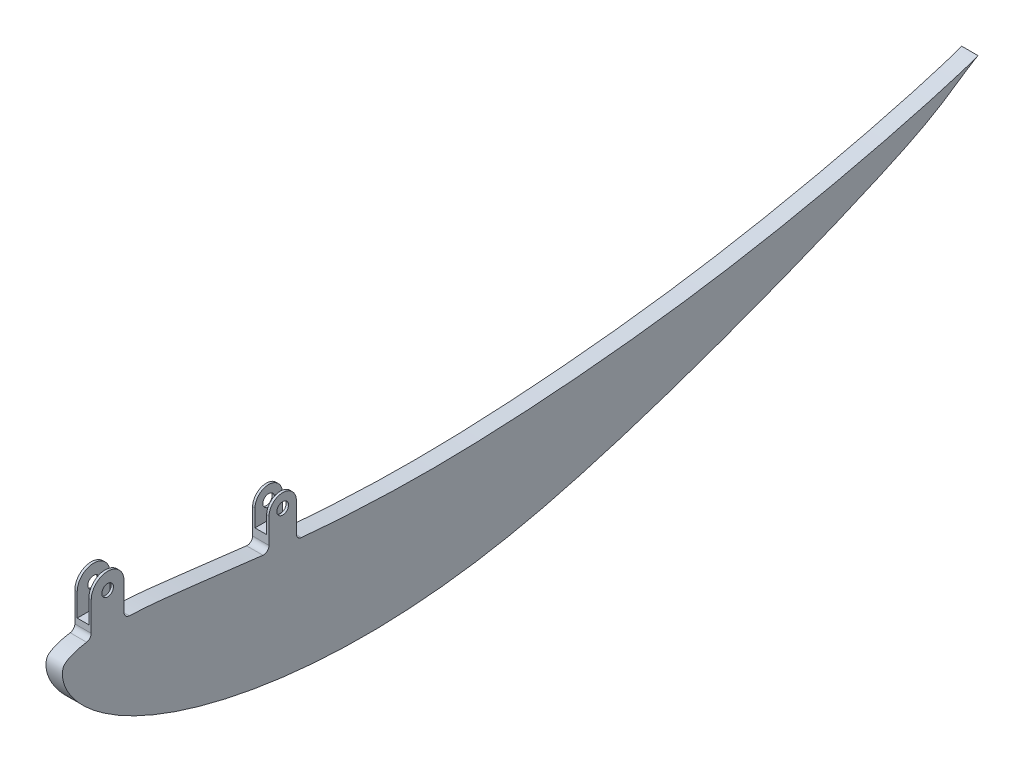
from build123d import *

# Parameters (mm, degrees)
SKETCH10_R          = 3.3782
BOSS_EXTRUDE3_DEPTH = 4.7625
FILLET1_R           = 3.175
SKETCH11_W          = 49.180841289
SKETCH11_H          = 41.157995699
SKETCH11_W_2        = 33.005126503
SKETCH11_H_2        = 27.785711149
CUT_EXTRUDE2_DEPTH  = 3.3782


with BuildPart() as part:
    # Sketch10 → Boss-Extrude3 (new, symmetric)
    with BuildSketch(Plane(origin=(-76.913317281, 0, 0), x_dir=(0, 0, -1), z_dir=(1, 0, 0))):
        with BuildLine():
            Line((424.6411251, 925.56881761), (424.6411251, 905.857301798))
            add(Edge.make_bspline(
                [(424.6411251, 905.857301798), (423.945652944, 905.774703814), (420.525882084, 905.325504915), (416.573283914, 904.537907427), (412.940662307, 903.120412878), (411.573177088, 902.472936622), (410.474599814, 901.817379847), (409.794744242, 901.335782482), (409.339677052, 900.920330878), (409.042207277, 900.619525556), (408.784556315, 900.303921905), (408.587304247, 899.955317553), (408.417771895, 899.584396657), (408.237439409, 899.045054034), (408.050985255, 898.323866051), (407.911585152, 897.226493937), (407.859927906, 894.999149718), (408.68651392, 890.840217441), (411.376000996, 884.946014898), (416.25391737, 878.254816024), (423.132675249, 871.411144687), (431.981552695, 864.594650088), (442.753920117, 857.982519555), (455.382043243, 851.727453866), (469.76495433, 845.961461457), (485.786519626, 840.806471362), (503.304073155, 836.369991877), (522.15856297, 832.757498728), (542.167589645, 830.052058954), (563.145876614, 828.350450786), (584.926560949, 827.796453196), (607.349161879, 828.463904852), (630.278164353, 830.40345119), (653.58544904, 833.656986938), (677.184512168, 838.243674796), (700.98973836, 844.111293992), (724.928449617, 850.915307518), (748.823162114, 858.397918758), (772.401865862, 866.368085261), (795.392079425, 874.604570932), (817.507453816, 882.912333682), (838.451534111, 891.127800517), (857.939094567, 899.08092447), (875.67746411, 906.643284295), (891.41607084, 913.715551659), (904.921254426, 920.249689629), (916.209983753, 926.570936945), (924.887186218, 932.328637386), (932.384753705, 937.363798289), (935.676703204, 939.716333859), (940.314704509, 942.154799385), (935.252865423, 940.050693146), (930.971572534, 938.763984852), (920.691607442, 935.460998702), (907.955315783, 931.908700898), (891.294887337, 927.47431092), (871.521761407, 922.604159426), (848.573928973, 917.416460042), (822.769468157, 912.150284242), (794.390431685, 907.047528902), (763.843566945, 902.44822661), (731.632596414, 898.583575164), (698.294192795, 895.504846252), (664.329350338, 893.303833795), (630.291363455, 892.15873472), (596.91773512, 892.45793122), (568.119025793, 893.993021629), (550.570865957, 895.432987488), (543.7036251, 896.066896175)],
                knots=[0.465548295, 0.465548295, 0.465548295, 0.465548295, 0.467425396, 0.47478648, 0.476279685, 0.477883717, 0.478839792, 0.479711359, 0.480113154, 0.480492024, 0.480846456, 0.481202587, 0.481563638, 0.481939612, 0.482727348, 0.483558572, 0.484902837, 0.488691659, 0.494806066, 0.502149414, 0.51079641, 0.520764117, 0.532061881, 0.544665778, 0.558541304, 0.573611819, 0.589802913, 0.607010014, 0.625106992, 0.64396663, 0.663469284, 0.683551422, 0.704141715, 0.725196117, 0.746680345, 0.768632951, 0.790977273, 0.813463266, 0.835826601, 0.857771603, 0.879002655, 0.899227861, 0.918150719, 0.935487385, 0.95098692, 0.964427758, 0.975827857, 0.985423652, 0.993088672, 0.998187309, 1, 1.001841176, 1.007308484, 1.016237151, 1.028456325, 1.043801368, 1.062125827, 1.083239553, 1.106895519, 1.132816624, 1.160612712, 1.18979101, 1.219873156, 1.250457487, 1.281126556, 1.311256566, 1.339998753, 1.35850705, 1.35850705, 1.35850705, 1.35850705], degree=3))
            Line((543.7036251, 896.066896175), (543.7036251, 915.880591264))
            ThreePointArc((543.7036251, 915.880591264), (535.7661251, 923.818091264), (527.8286251, 915.880591264))
            Line((527.8286251, 915.880591264), (527.8286251, 897.654368203))
            add(Edge.make_bspline(
                [(527.8286251, 897.654368203), (521.147965041, 898.371745986), (506.632962869, 900.058010227), (485.466358702, 902.814843608), (465.32608372, 905.166410987), (451.766780725, 906.204699649), (444.906008083, 906.461422369), (443.6911251, 906.496403706)],
                knots=[1.372779583, 1.372779583, 1.372779583, 1.372779583, 1.390812035, 1.411995107, 1.43006872, 1.445223789, 1.448484048, 1.448484048, 1.448484048, 1.448484048], degree=3))
            Line((443.6911251, 906.496403706), (443.6911251, 925.56881761))
            ThreePointArc((443.6911251, 925.56881761), (434.1661251, 935.09381761), (424.6411251, 925.56881761))
        make_face()
        with Locations((434.1661251, 925.56881761)):
            Circle(SKETCH10_R, mode=Mode.SUBTRACT)
        with Locations((535.7661251, 915.880591264)):
            Circle(SKETCH10_R, mode=Mode.SUBTRACT)
    extrude(amount=BOSS_EXTRUDE3_DEPTH, both=True)

    # Fillet1
    fillet1_edges = [part.edges().sort_by_distance(p)[0] for p in [
        (-74.532067281, 897.654368203, -527.8286251),
        (-79.294567281, 896.066896175, -543.7036251),
        (-79.294567281, 906.496403706, -443.6911251),
        (-74.532067281, 905.857301798, -424.6411251),
    ]]
    fillet(fillet1_edges, radius=FILLET1_R)

    # Sketch11 → Cut-Extrude2 (cut, symmetric)
    with BuildSketch(Plane(origin=(-76.913317281, 0, 0), x_dir=(0, 0, -1), z_dir=(1, 0, 0))):
        with Locations((438.21137293, 932.786299648)):
            Rectangle(SKETCH11_W, SKETCH11_H)
        with Locations((537.438895622, 919.849255738)):
            Rectangle(SKETCH11_W_2, SKETCH11_H_2)
    extrude(amount=CUT_EXTRUDE2_DEPTH, both=True, mode=Mode.SUBTRACT)


solid = part.part
